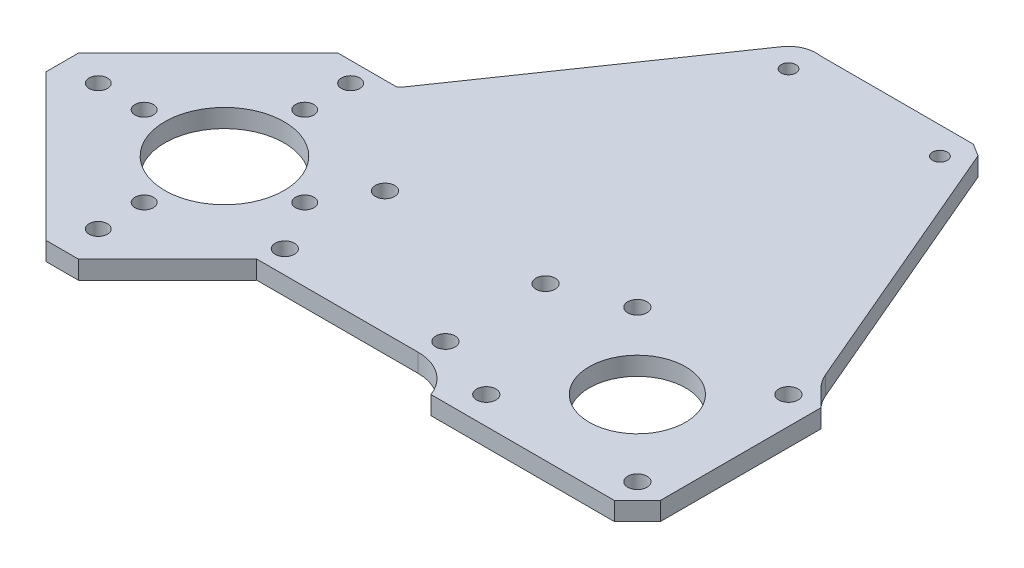
from build123d import *

# Parameters (mm, degrees)
SKETCH_1_R          = 2.1
SKETCH_1_R_2        = 10.5
SKETCH_1_R_3        = 10
EXTRUDE_1_DEPTH     = 4
CHAMFER_1_SIZE      = 5
FILLET_1_R          = 10
SKETCH_2_R          = 2.1
CUT_EXTRUDE_1_DEPTH = 10
EXTRUDE_START       = -4
SKETCH_3_R          = 1.6
EXTRUDE_2_DEPTH     = 4
FILLET_2_R          = 3
FILLET_3_R          = 11
SKETCH_4_R          = 1.6
EXTRUDE_3_DEPTH     = 4
FILLET_4_R          = 10
CHAMFER_2_SIZE      = 2
CHAMFER_2_SIZE2     = 1.851556395
FILLET_5_R          = 10
SKETCH_5_R          = 11.237062383
EXTRUDE_4_DEPTH     = 4
EXTRUDE_5_DEPTH     = 14
SKETCH_7_R          = 13
EXTRUDE_6_DEPTH     = 14
EXTRUDE_7_DEPTH     = 14
EXTRUDE_8_DEPTH     = 4


with BuildPart() as part:
    # 草图1 → 凸台-拉伸1 (new body)
    with BuildSketch(Plane(origin=(0, 0, 0), x_dir=(1, 0, 0), z_dir=(0, 1, 0))):
        Polygon((0, 31.819805153), (-31.819805153, 0), (0, -31.819805153), (15.909902577, -15.909902577), (67.5, -15.909902577), (67.5, -22.5), (112.5, -22.5), (112.5, 22.5), (67.5, 22.5), (67.5, 15.909902577), (15.909902577, 15.909902577), align=None)
        with Locations(Location((0, 14, 0), (0, 0, 270))):
            Circle(SKETCH_1_R, mode=Mode.SUBTRACT)
        with Locations(Location((14, 0, 0), (0, 0, 270))):
            Circle(SKETCH_1_R, mode=Mode.SUBTRACT)
        with Locations(Location((0, -14, 0), (0, 0, 270))):
            Circle(SKETCH_1_R, mode=Mode.SUBTRACT)
        with Locations(Location((-14, 0, 0), (0, 0, 270))):
            Circle(SKETCH_1_R, mode=Mode.SUBTRACT)
        with Locations(Location((90, 0, 0), (0, 0, 270))):
            Circle(SKETCH_1_R_2, mode=Mode.SUBTRACT)
        with Locations(Location((0, 22.5, 0), (0, 0, 270))):
            Circle(SKETCH_1_R, mode=Mode.SUBTRACT)
        with Locations(Location((0, -22.5, 0), (0, 0, 270))):
            Circle(SKETCH_1_R, mode=Mode.SUBTRACT)
        with Locations(Location((0, 0, 0), (0, 0, 270))):
            Circle(SKETCH_1_R_3, mode=Mode.SUBTRACT)
        with Locations(Location((-22.5, 0, 0), (0, 0, 270))):
            Circle(SKETCH_1_R, mode=Mode.SUBTRACT)
    extrude(amount=EXTRUDE_1_DEPTH)

    # 倒角1
    chamfer_1_edges = [part.edges().sort_by_distance(p)[0] for p in [
        (112.5, 2, -22.5),
        (112.5, 2, 22.5),
        (0, 2, 31.819805153),
        (-31.819805153, 2, 0),
        (0, 2, -31.819805153),
    ]]
    chamfer(chamfer_1_edges, length=CHAMFER_1_SIZE)

    # 圆角1
    # the kernel refuses this fillet: 10 mm, written as the material it adds along each edge
    with BuildSketch(Plane(origin=(15.909902577, 0, -15.909902577), x_dir=(-0.707106781186552, 0, -0.707106781186543), z_dir=(0, 1, 0))) as fillet_1_piece_1:
        with BuildLine():
            CenterArc((FILLET_1_R * 0.414213562373, -FILLET_1_R), FILLET_1_R, 90, 45)
            Line((-FILLET_1_R * 0.292893218813, -FILLET_1_R * 0.292893218813), (-FILLET_1_R * 0.307035354437, -FILLET_1_R * 0.27875108319))
            Line((-FILLET_1_R * 0.307035354437, -FILLET_1_R * 0.27875108319), (-FILLET_1_R * 0.00828427124746, FILLET_1_R * 0.02))
            Line((-FILLET_1_R * 0.00828427124746, FILLET_1_R * 0.02), (FILLET_1_R * 0.414213562373, FILLET_1_R * 0.02))
            Line((FILLET_1_R * 0.414213562373, FILLET_1_R * 0.02), (FILLET_1_R * 0.414213562373, 0))
        make_face()
    extrude(amount=4)
    with BuildSketch(Plane(origin=(15.909902577, 0, 15.909902577), x_dir=(-0.7071067811865422, 0, 0.707106781186553), z_dir=(0, 1, 0))) as fillet_1_piece_2:
        with BuildLine():
            CenterArc((FILLET_1_R * 0.414213562373, FILLET_1_R), FILLET_1_R, 225, 45)
            Line((-FILLET_1_R * 0.292893218813, FILLET_1_R * 0.292893218813), (-FILLET_1_R * 0.307035354437, FILLET_1_R * 0.27875108319))
            Line((-FILLET_1_R * 0.307035354437, FILLET_1_R * 0.27875108319), (-FILLET_1_R * 0.00828427124746, -FILLET_1_R * 0.02))
            Line((-FILLET_1_R * 0.00828427124746, -FILLET_1_R * 0.02), (FILLET_1_R * 0.414213562373, -FILLET_1_R * 0.02))
            Line((FILLET_1_R * 0.414213562373, -FILLET_1_R * 0.02), (FILLET_1_R * 0.414213562373, 0))
        make_face()
    extrude(amount=4)
    with BuildSketch(Plane(origin=(67.5, 0, 15.909902577), x_dir=(-1, 0, 0), z_dir=(0, 1, 0))) as fillet_1_piece_3:
        with BuildLine():
            CenterArc((9.400668296, 10), FILLET_1_R, 199.937217397, 70.062782603)
            Line((0, 6.590097423), (-0.188013366, 6.521899372))
            ThreePointArc((-0.188013366, 6.521899372), (-0.2, 3.295048712), (-0.2, 0))
            Line((-0.2, 0), (0, -0.2))
            Line((0, -0.2), (9.400668296, -0.2))
            Line((9.400668296, -0.2), (9.400668296, 0))
        make_face()
    extrude(amount=4)
    with BuildSketch(Plane(origin=(67.5, 0, -15.909902577), x_dir=(-1, 0, 0), z_dir=(0, 1, 0))) as fillet_1_piece_4:
        with BuildLine():
            CenterArc((9.400668296, -10), FILLET_1_R, 90, 70.062782603)
            Line((0, -6.590097423), (-0.188013366, -6.521899372))
            ThreePointArc((-0.188013366, -6.521899372), (-0.2, -3.295048712), (-0.2, 0))
            Line((-0.2, 0), (0, 0.2))
            Line((0, 0.2), (9.400668296, 0.2))
            Line((9.400668296, 0.2), (9.400668296, 0))
        make_face()
    extrude(amount=4)

    # 草图2 → 切除-拉伸1 (cut)
    with BuildSketch(Plane.XZ):
        with Locations(Location((106.464466094, 16.464466094, 0), (0, 0, 270))):
            Circle(SKETCH_2_R)
        with Locations(Location((106.464466094, -16.464466094, 0), (0, 0, 270))):
            Circle(SKETCH_2_R)
        with Locations(Location((73.535533906, -16.464466094, 0), (0, 0, 90))):
            Circle(SKETCH_2_R)
        with Locations(Location((73.535533906, 16.464466094, 0), (0, 0, 90))):
            Circle(SKETCH_2_R)
        with Locations(Location((24.075684952, 10.909902577, 0), (0, 0, 270))):
            Circle(SKETCH_2_R)
        with Locations(Location((59.075684952, 10.909902577, 0), (0, 0, 270))):
            Circle(SKETCH_2_R)
        with Locations(Location((59.075684952, -10.909902577, 0), (0, 0, 90))):
            Circle(SKETCH_2_R)
        with Locations(Location((24.075684952, -10.909902577, 0), (0, 0, 90))):
            Circle(SKETCH_2_R)
    extrude(amount=-CUT_EXTRUDE_1_DEPTH, mode=Mode.SUBTRACT)

    # 草图3 → 凸台-拉伸2 (add)
    with BuildSketch(Plane(origin=(0, 4, 0), x_dir=(1, 0, 0), z_dir=(0, 1, 0)).offset(EXTRUDE_START)):
        with BuildLine():
            Line((3.535533906, 28.284271247), (40.057636417, 81.344203773))
            ThreePointArc((40.057636417, 81.344203773), (45.94930127, 83.86671265), (50.75784592, 79.629654221))
            Line((50.75784592, 79.629654221), (67.5, 22.5))
            ThreePointArc((67.5, 22.5), (63.839583189, 17.721525883), (58.099331704, 15.909902577))
            Line((58.099331704, 15.909902577), (20.0520382, 15.909902577))
            ThreePointArc((20.0520382, 15.909902577), (16.225203877, 16.671107252), (12.980970389, 18.838834765))
            Line((12.980970389, 18.838834765), (3.535533906, 28.284271247))
        make_face()
        with Locations(Location((45, 77.942286341, 0), (0, 0, 270))):
            Circle(SKETCH_3_R, mode=Mode.SUBTRACT)
        Polygon((16.491758356, 29.470182421), (43.526560522, 68.746803428), (56.080145943, 25.909902577), (20.0520382, 25.909902577), align=None, mode=Mode.SUBTRACT)
    extrude(amount=EXTRUDE_2_DEPTH)

    # 圆角2
    fillet_2_edges = [part.edges().sort_by_distance(p)[0] for p in [
        (16.491758356, 2, -29.470182421),
        (43.526560522, 2, -68.746803428),
        (56.080145943, 2, -25.909902577),
        (20.0520382, 2, -25.909902577),
    ]]
    fillet(fillet_2_edges, radius=FILLET_2_R)

    # 圆角3
    fillet_3_edges = [part.edges().sort_by_distance(p)[0] for p in [
        (67.5, 2, -22.5),
        (3.535533906, 2, -28.284271247),
    ]]
    fillet(fillet_3_edges, radius=FILLET_3_R)

    # 草图4 → 凸台-拉伸3 (add)
    with BuildSketch(Plane(origin=(0, 4, 0), x_dir=(1, 0, 0), z_dir=(0, 1, 0)).offset(EXTRUDE_START)):
        with BuildLine():
            Line((45.94930127, 83.86671265), (81.347717681, 83.86671265))
            Line((81.347717681, 83.86671265), (107.5, 22.5))
            Line((107.5, 22.5), (97.716806526, 22.5))
            Line((97.716806526, 22.5), (75.4, 74.86671265))
            Line((75.4, 74.86671265), (52.153651701, 74.86671265))
            Line((52.153651701, 74.86671265), (50.75784592, 79.629654221))
            ThreePointArc((50.75784592, 79.629654221), (48.966689034, 82.443994695), (45.94930127, 83.86671265))
        make_face()
        with Locations(Location((78, 77.942286341, 0), (0, 0, 270))):
            Circle(SKETCH_4_R, mode=Mode.SUBTRACT)
    extrude(amount=EXTRUDE_3_DEPTH)

    # 圆角4
    fillet_4_edges = [part.edges().sort_by_distance(p)[0] for p in [
        (97.716806526, 2, -22.5),
        (75.4, 2, -74.86671265),
        (52.153651701, 2, -74.86671265),
    ]]
    fillet(fillet_4_edges, radius=FILLET_4_R)

    # 倒角2
    chamfer_2_edges = [part.edges().sort_by_distance(p)[0] for p in [
        (81.347717681, 2, -83.86671265),
    ]]
    chamfer_2_side = [part.faces().sort_by_distance(p)[0] for p in [
        (63.648509476, 2, -83.86671265),
    ]]
    chamfer(chamfer_2_edges, length=CHAMFER_2_SIZE, length2=CHAMFER_2_SIZE2, reference=chamfer_2_side[0])

    # 圆角5
    fillet_5_edges = [part.edges().sort_by_distance(p)[0] for p in [
        (107.5, 2, -22.5),
    ]]
    fillet(fillet_5_edges, radius=FILLET_5_R)

    # 草图5 → 凸台-拉伸4 (add)
    with BuildSketch(Plane(origin=(0, 4, 0), x_dir=(1, 0, 0), z_dir=(0, 1, 0))):
        Polygon((5.832808457, 31.819805153), (-7.071067812, 31.819805153), (-35.355339059, 3.535533906), (-35.355339059, -3.535533906), (-3.535533906, -35.355339059), (3.535533906, -35.355339059), (22.936205659, -15.954667306), (16.526788584, -9.545250231), (26.5976855, 0.525646685), align=None)
        Circle(SKETCH_5_R, mode=Mode.SUBTRACT)
    extrude(amount=-EXTRUDE_4_DEPTH)


with BuildPart() as body_2:
    # 草图6 → 凸台-拉伸5 (new body)
    with BuildSketch(Plane(origin=(0, 4, 0), x_dir=(1, 0, 0), z_dir=(0, 1, 0))):
        with BuildLine():
            ThreePointArc((2, 27.5), (1.414213562, 28.914213562), (0, 29.5))
            Line((0, 29.5), (0, 25.5))
            ThreePointArc((0, 25.5), (1.414213562, 26.085786438), (2, 27.5))
        make_face()
        with BuildLine():
            Line((0, 25.5), (0, 29.5))
            ThreePointArc((0, 29.5), (-2, 27.5), (0, 25.5))
        make_face()
        with BuildLine():
            ThreePointArc((-29.5, 0), (-27.5, -2), (-25.5, 0))
            Line((-25.5, 0), (-29.5, 0))
        make_face()
        with BuildLine():
            Line((-29.5, 0), (-25.5, 0))
            ThreePointArc((-25.5, 0), (-27.5, 2), (-29.5, 0))
        make_face()
        with BuildLine():
            ThreePointArc((2, -27.5), (1.414213562, -26.085786438), (0, -25.5))
            Line((0, -25.5), (0, -29.5))
            ThreePointArc((0, -29.5), (1.414213562, -28.914213562), (2, -27.5))
        make_face()
        with BuildLine():
            Line((0, -29.5), (0, -25.5))
            ThreePointArc((0, -25.5), (-2, -27.5), (0, -29.5))
        make_face()
    extrude(amount=-EXTRUDE_5_DEPTH)


with BuildPart() as part_1:
    add(part.part)

    # Combine 1: cut body 2
    add(body_2.part, mode=Mode.SUBTRACT)


with BuildPart() as body_2_2:
    # 草图7 → 凸台-拉伸6 (new body)
    with BuildSketch(Plane(origin=(0, 4, 0), x_dir=(1, 0, 0), z_dir=(0, 1, 0))):
        with Locations(Location((0, 0, 0), (0, 0, 270))):
            Circle(SKETCH_7_R)
    extrude(amount=-EXTRUDE_6_DEPTH)


with BuildPart() as part_2:
    add(part_1.part)

    # Combine 2: cut body 2 2
    add(body_2_2.part, mode=Mode.SUBTRACT)


with BuildPart() as body_2_3:
    # 草图9 → 凸台-拉伸7 (new body)
    with BuildSketch(Plane(origin=(0, 4, 0), x_dir=(1, 0, 0), z_dir=(0, 1, 0))):
        with BuildLine():
            ThreePointArc((2, 17.5), (1.414213562, 18.914213562), (0, 19.5))
            Line((0, 19.5), (0, 15.5))
            ThreePointArc((0, 15.5), (1.414213562, 16.085786438), (2, 17.5))
        make_face()
        with BuildLine():
            Line((0, 15.5), (0, 19.5))
            ThreePointArc((0, 19.5), (-2, 17.5), (0, 15.5))
        make_face()
        with BuildLine():
            ThreePointArc((-19.5, 0), (-17.5, -2), (-15.5, 0))
            Line((-15.5, 0), (-19.5, 0))
        make_face()
        with BuildLine():
            Line((-19.5, 0), (-15.5, 0))
            ThreePointArc((-15.5, 0), (-17.5, 2), (-19.5, 0))
        make_face()
        with BuildLine():
            ThreePointArc((19.5, 0), (17.5, 2), (15.5, 0))
            Line((15.5, 0), (19.5, 0))
        make_face()
        with BuildLine():
            Line((19.5, 0), (15.5, 0))
            ThreePointArc((15.5, 0), (17.5, -2), (19.5, 0))
        make_face()
        with BuildLine():
            ThreePointArc((2, -17.5), (1.414213562, -16.085786438), (0, -15.5))
            Line((0, -15.5), (0, -19.5))
            ThreePointArc((0, -19.5), (1.414213562, -18.914213562), (2, -17.5))
        make_face()
        with BuildLine():
            Line((0, -19.5), (0, -15.5))
            ThreePointArc((0, -15.5), (-2, -17.5), (0, -19.5))
        make_face()
    extrude(amount=-EXTRUDE_7_DEPTH)


with BuildPart() as part_3:
    add(part_2.part)

    # Combine 3: cut body 2 3
    add(body_2_3.part, mode=Mode.SUBTRACT)

    # 草图10 → 凸台-拉伸8 (add)
    with BuildSketch(Plane(origin=(0, 4, 0), x_dir=(1, 0, 0), z_dir=(0, 1, 0))):
        Polygon((38.788036592, 70.617275828), (7.35342379, 23.562877905), (103.706674861, 21.100966292), (80.486560921, 74.925699017), (61.534006424, 75.40995371), align=None)
    extrude(amount=-EXTRUDE_8_DEPTH)


solid = part_3.part
